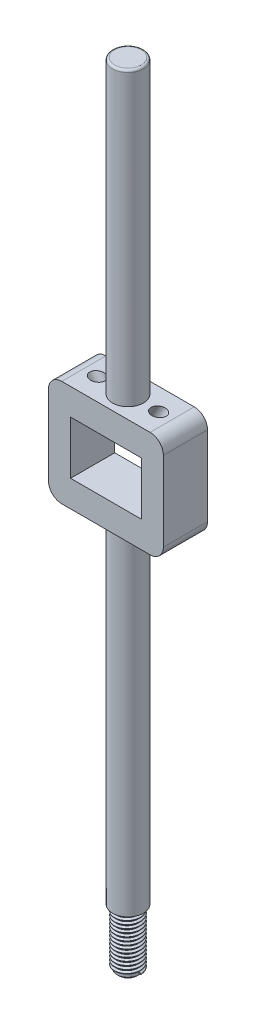
from build123d import *

# Parameters (mm, degrees)
BOSS_EXTRUDE1_DEPTH      = 5
BOSS_EXTRUDE1_DEPTH_BACK = 5
SKETCH1_W                = 16
SKETCH1_H                = 12
SKETCH3_R                = 3.5
BOSS_EXTRUDE2_DEPTH      = 66
FILLET1_R                = 0.5
CUT_EXTRUDE1_DEPTH       = 25
CUT_EXTRUDE1_DEPTH_BACK  = 64.461056442
SKETCH5_R                = 1.5
CUT_EXTRUDE2_DEPTH       = 23
CUT_EXTRUDE2_DEPTH_BACK  = 63.237457075
SKETCH7_R                = 1.5
BOSS_EXTRUDE3_START      = 76
SKETCH8_R                = 3.5
BOSS_EXTRUDE3_DEPTH      = 76
SKETCH9_R                = 2.5
BOSS_EXTRUDE4_DEPTH      = 13
CHAMFER1_SIZE            = 0.45
THREAD1_PITCH            = 0.8


with BuildPart() as part:
    # Sketch1 → Boss-Extrude1 (new, two sides: drawn at the far end of the back side and taken through both)
    with BuildSketch(Plane.XY.offset(-BOSS_EXTRUDE1_DEPTH_BACK)):
        with BuildLine():
            Line((-12, 12), (8, 12))
            ThreePointArc((8, 12), (10.121320344, 11.121320344), (11, 9))
            Line((11, 9), (11, -9))
            ThreePointArc((11, -9), (10.121320344, -11.121320344), (8, -12))
            Line((8, -12), (-12, -12))
            ThreePointArc((-12, -12), (-14.121320344, -11.121320344), (-15, -9))
            Line((-15, -9), (-15, 9))
            ThreePointArc((-15, 9), (-14.121320344, 11.121320344), (-12, 12))
        make_face()
        with Locations((-2, 0)):
            Rectangle(SKETCH1_W, SKETCH1_H, mode=Mode.SUBTRACT)
    extrude(amount=BOSS_EXTRUDE1_DEPTH + BOSS_EXTRUDE1_DEPTH_BACK)

    # Sketch3 → Boss-Extrude2 (add)
    with BuildSketch(Plane(origin=(0, 12, 0), x_dir=(1, 0, 0), z_dir=(0, 1, 0))):
        with Locations(Location((-2, 0, 0), (0, 0, 90))):
            Circle(SKETCH3_R)
    extrude(amount=BOSS_EXTRUDE2_DEPTH)

    # Fillet1
    fillet1_edges = [part.edges().sort_by_distance(p)[0] for p in [
        (-2, 78, 3.5),
    ]]
    fillet(fillet1_edges, radius=FILLET1_R)

    # Sketch5 → Cut-Extrude1 (cut, two sides: drawn at the far end of the back side and taken through both)
    with BuildSketch(Plane(origin=(12.002047299, 20.788155716, 0), x_dir=(0.8660254037844417, -0.4999999999999946, 0), z_dir=(-0.4999999999999946, -0.8660254037844417, 0)).offset(-CUT_EXTRUDE1_DEPTH_BACK)):
        with Locations((-1.732050808, 0)):
            Circle(SKETCH5_R)
    extrude(amount=CUT_EXTRUDE1_DEPTH + CUT_EXTRUDE1_DEPTH_BACK, mode=Mode.SUBTRACT)

    # Sketch7 → Cut-Extrude2 (cut, two sides: drawn at the far end of the back side and taken through both)
    with BuildSketch(Plane(origin=(-11.700774937, 20.266336679, 0), x_dir=(0.8660254037844443, 0.49999999999999034, 0), z_dir=(0.49999999999999034, -0.8660254037844443, 0)).offset(-CUT_EXTRUDE2_DEPTH_BACK)):
        with Locations(Location((-1.732050808, 0, 0), (0, 0, 180))):
            Circle(SKETCH7_R)
    extrude(amount=CUT_EXTRUDE2_DEPTH + CUT_EXTRUDE2_DEPTH_BACK, mode=Mode.SUBTRACT)

    # Sketch8 → Boss-Extrude3 (add)
    with BuildSketch(Plane.XZ.offset(12).offset(BOSS_EXTRUDE3_START)):
        with Locations(Location((-2, 0, 0), (0, 0, 270))):
            Circle(SKETCH8_R)
    extrude(amount=-BOSS_EXTRUDE3_DEPTH)

    # Sketch9 → Boss-Extrude4 (add)
    with BuildSketch(Plane.XZ.offset(88)):
        with Locations(Location((-2, 0, 0), (0, 0, 90))):
            Circle(SKETCH9_R)
    extrude(amount=BOSS_EXTRUDE4_DEPTH)

    # Chamfer1
    chamfer1_edges = [part.edges().sort_by_distance(p)[0] for p in [
        (-2, -101, -2.5),
    ]]
    chamfer(chamfer1_edges, length=CHAMFER1_SIZE)

    # Thread1: the profile of Thread Profile1 profile screwed along a right-hand helix of 15.6875 turns, 8 arcs to a turn; built about Z, then put on its axis
    thread1_z = Axis((0, 0, 0), (0, 0, 1))
    thread1_corners = [(2.4997, 0, -0.000173205), (2.9330127, 0, 0.249999999), (2.9330127, 0, 0.349999999), (2.4997, 0, 0.600173203)]
    with BuildLine(mode=Mode.PRIVATE) as thread1_profile:
        Line(thread1_corners[0], thread1_corners[1])
        Line(thread1_corners[1], thread1_corners[2])
        Line(thread1_corners[2], thread1_corners[3])
        Line(thread1_corners[3], thread1_corners[0])
    thread1_cap = Face(thread1_profile.wire())
    thread1_turn_angles = [0, 22.5, 45, 67.5, 90, 112.5, 135, 157.5, 180, 202.5, 225, 247.5, 270, 292.5, 315, 337.5, 360]
    thread1_turn_weights = [1, 0.9238795325112867, 1, 0.9238795325112867, 1, 0.9238795325112867, 1, 0.9238795325112867, 1, 0.9238795325112867, 1, 0.9238795325112867, 1, 0.9238795325112867, 1, 0.9238795325112867, 1]
    thread1_turn_rails = [Edge.make_bspline([Vector(p[0], p[1], 0).rotate(thread1_z, thread1_turn_angles[k]) / thread1_turn_weights[k] + Vector(0, 0, p[2] + THREAD1_PITCH * thread1_turn_angles[k] / 360) for k in range(17)], [0, 0, 0, 1, 1, 2, 2, 3, 3, 4, 4, 5, 5, 6, 6, 7, 7, 8, 8, 8], 2, thread1_turn_weights) for p in thread1_corners]
    thread1_turn_sides = [Face.make_surface_from_curves(thread1_turn_rails[p[0]], thread1_turn_rails[p[1]]) for p in [(0, 1), (1, 2), (2, 3), (3, 0)]]
    thread1_last_angles = [5400, 5422.5, 5445, 5467.5, 5490, 5512.5, 5535, 5557.5, 5580, 5602.5, 5625, 5636.25, 5647.5]
    thread1_last_weights = [1, 0.9238795325112867, 1, 0.9238795325112867, 1, 0.9238795325112867, 1, 0.9238795325112867, 1, 0.9238795325112867, 1, 0.9807852804031638, 1]
    thread1_last_rails = [Edge.make_bspline([Vector(p[0], p[1], 0).rotate(thread1_z, thread1_last_angles[k]) / thread1_last_weights[k] + Vector(0, 0, p[2] + THREAD1_PITCH * thread1_last_angles[k] / 360) for k in range(13)], [0, 0, 0, 1, 1, 2, 2, 3, 3, 4, 4, 5, 5, 6, 6, 6], 2, thread1_last_weights) for p in thread1_corners]
    thread1_last_sides = [Face.make_surface_from_curves(thread1_last_rails[p[0]], thread1_last_rails[p[1]]) for p in [(0, 1), (1, 2), (2, 3), (3, 0)]]
    thread1 = Plane(origin=(-2, -100.55, 0), x_dir=(1, 0, 0), z_dir=(0, 1, 0)) * Solid(Shell([*[p.moved(Location((0, 0, THREAD1_PITCH * i))) for i in range(15) for p in thread1_turn_sides], *thread1_last_sides, thread1_cap, thread1_cap.rotate(thread1_z, 5647.5).moved(Location((0, 0, THREAD1_PITCH * 5647.5 / 360)))]))
    add(thread1)


solid = part.part
